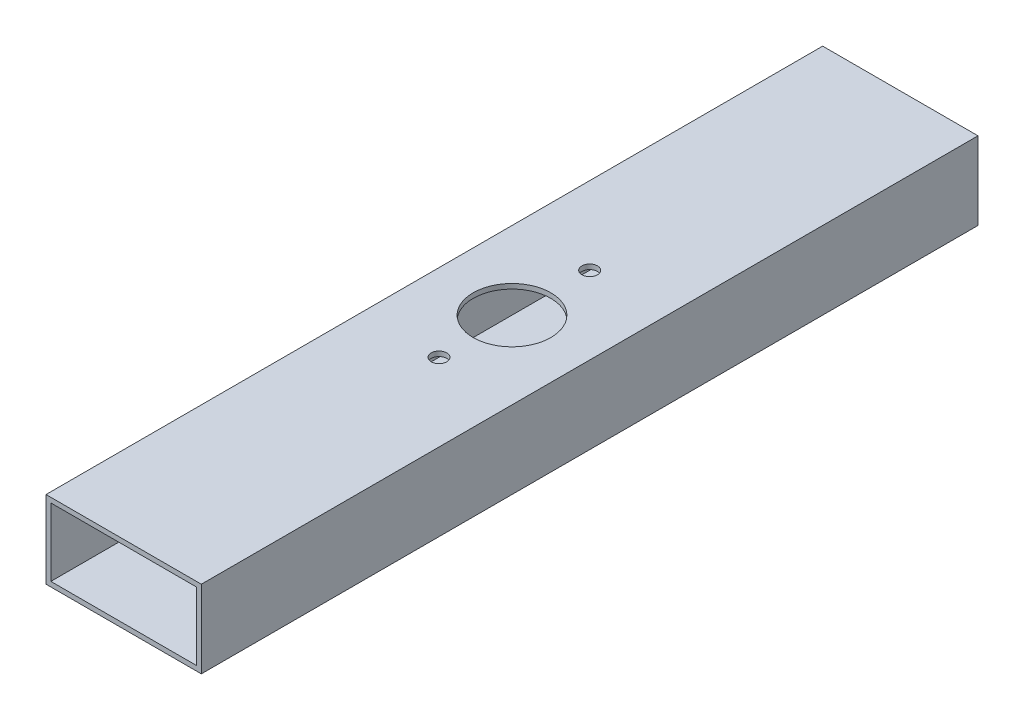
from build123d import *

# Parameters (mm, degrees)
SKETCH1_W           = 50.8
SKETCH1_H           = 25.4
SKETCH1_W_2         = 47.625
SKETCH1_H_2         = 22.225
BOSS_EXTRUDE1_DEPTH = 254
SKETCH2_R           = 12.7
SKETCH2_R_2         = 2.54
CUT_EXTRUDE1_DEPTH  = 257.527425434


with BuildPart() as part:
    # Sketch1 → Boss-Extrude1 (new body)
    with BuildSketch(Plane.XY):
        Rectangle(SKETCH1_W, SKETCH1_H)
        Rectangle(SKETCH1_W_2, SKETCH1_H_2, mode=Mode.SUBTRACT)
    extrude(amount=BOSS_EXTRUDE1_DEPTH)

    # Sketch2 → Cut-Extrude1 (cut, through all)
    with BuildSketch(Plane(origin=(0, 12.7, 0), x_dir=(1, 0, 0), z_dir=(0, 1, 0))):
        with Locations((0, -127)):
            Circle(SKETCH2_R)
        with Locations((0, -101.6)):
            Circle(SKETCH2_R_2)
        with Locations((0, -150.876)):
            Circle(SKETCH2_R_2)
    extrude(amount=-CUT_EXTRUDE1_DEPTH, mode=Mode.SUBTRACT)


solid = part.part
